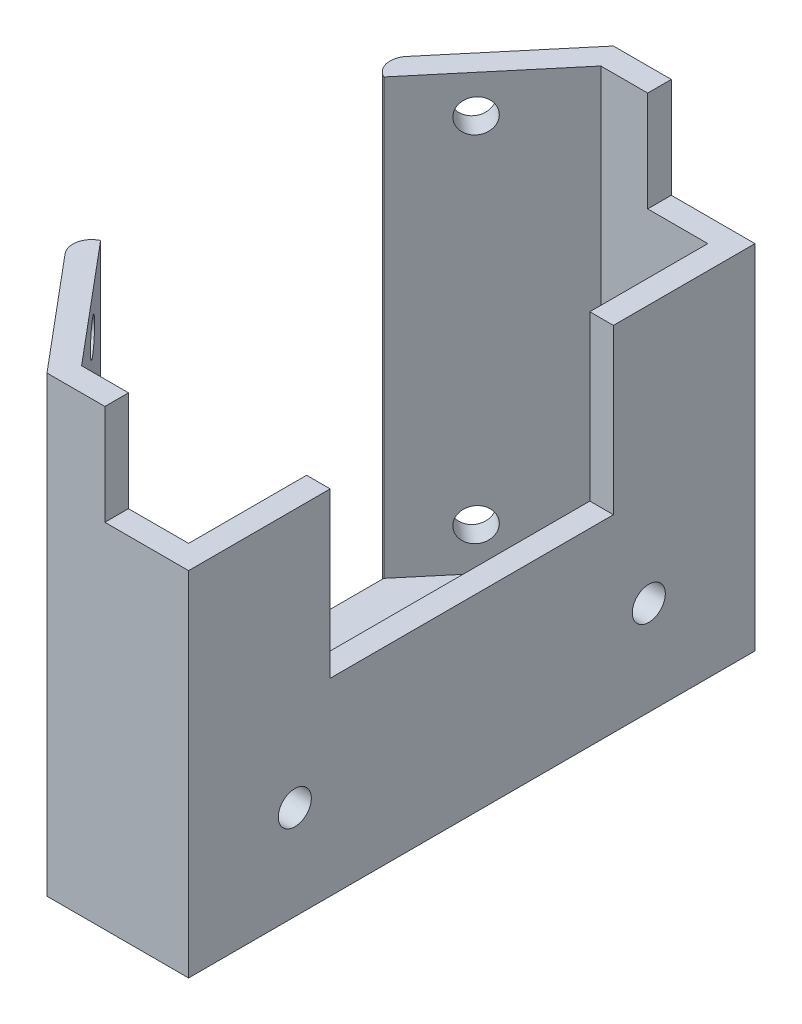
from build123d import *

# Parameters (mm, degrees)
SKETCH_1_W          = 15
SKETCH_1_H          = 60
EXTRUDE_1_DEPTH     = 55
CUT_EXTRUDE_1_DEPTH = 53
SKETCH_3_W          = 78.566437997
SKETCH_3_H          = 30
CUT_EXTRUDE_2_DEPTH = 35
CUT_EXTRUDE_3_DEPTH = 25
FILLET_1_R          = 2
SKETCH_5_R          = 1.75
CUT_EXTRUDE_4_DEPTH = 3
SKETCH_6_R          = 1.75
CUT_EXTRUDE_5_DEPTH = 3
SKETCH_7_R          = 1.75
CUT_EXTRUDE_6_DEPTH = 3
SKETCH_8_W          = 60
SKETCH_8_H          = 7
CUT_EXTRUDE_7_DEPTH = 68.625993731
SKETCH_9_R          = 1.75
CUT_EXTRUDE_8_DEPTH = 10
SKETCH_10_W         = 8.867546431
SKETCH_10_H         = 10.62822389
CUT_EXTRUDE_9_DEPTH = 78


with BuildPart() as part:
    # 草图1 → 凸台-拉伸1 (new body)
    with BuildSketch(Plane(origin=(0, 0, 0), x_dir=(1, 0, 0), z_dir=(0, 1, 0))):
        Polygon((-7.5, 30), (-32.672988935, 0), (-7.5, -30), align=None)
        Rectangle(SKETCH_1_W, SKETCH_1_H)
    extrude(amount=EXTRUDE_1_DEPTH)

    # 草图2 → 切除-拉伸1 (cut)
    with BuildSketch(Plane(origin=(0, 55, 0), x_dir=(1, 0, 0), z_dir=(0, 1, 0))):
        Polygon((-6.334230855, 27.5), (-29.409470712, 0), (-6.334230855, -27.5), (5, -27.5), (5, 27.5), align=None)
    extrude(amount=-CUT_EXTRUDE_1_DEPTH, mode=Mode.SUBTRACT)

    # 草图3 → 切除-拉伸2 (cut)
    with BuildSketch(Plane(origin=(0, 55, 0), x_dir=(1, 0, 0), z_dir=(0, 1, 0))):
        with Locations((-12.586494467, 0)):
            Rectangle(SKETCH_3_W, SKETCH_3_H)
    extrude(amount=-CUT_EXTRUDE_2_DEPTH, mode=Mode.SUBTRACT)

    # 草图4 → 切除-拉伸3 (cut)
    with BuildSketch(Plane(origin=(0, 20, 0), x_dir=(1, 0, 0), z_dir=(0, 1, 0))):
        Polygon((-16.822976244, 15), (-73.584466249, 15), (-53.824577323, -15), (-16.822976244, -15), align=None)
    extrude(amount=-CUT_EXTRUDE_3_DEPTH, mode=Mode.SUBTRACT)

    # 圆角1
    # the kernel refuses this fillet: 2 mm, written as the material it takes off along each edge
    with BuildSketch(Plane(origin=(-20.086494468, 65.085601878, 15), x_dir=(1, 0, 0), z_dir=(0, -1, 0))) as fillet_1_piece_1:
        with BuildLine():
            CenterArc((4.125248856, 1.80483249), FILLET_1_R, 140, 104.477512186)
            Line((2.593159969, 3.09040771), (2.562518192, 3.116119214))
            Line((2.562518192, 3.116119214), (-0.030641778, 0.025711504))
            Line((-0.030641778, 0.025711504), (0, -0.04))
            ThreePointArc((0, -0.04), (1.631759112, -0.04), (3.246283611, -0.03609665))
            Line((3.246283611, -0.03609665), (3.263518223, 0))
        make_face()
    extrude(amount=75.171203755, mode=Mode.SUBTRACT)
    with BuildSketch(Plane(origin=(-20.086494468, -10.085601878, -15), x_dir=(0.6427876096865405, 0, -0.7660444431189769), z_dir=(0, 1, 0))) as fillet_1_piece_2:
        with BuildLine():
            CenterArc((4.034240751, -2), FILLET_1_R, 90, 104.477512186)
            Line((2.097749078, -2.5), (2.059019244, -2.51))
            ThreePointArc((2.059019244, -2.51), (1.018232761, -1.275711504), (-0.030641778, -0.025711504))
            Line((-0.030641778, -0.025711504), (0, 0.04))
            Line((0, 0.04), (4.034240751, 0.04))
            Line((4.034240751, 0.04), (4.034240751, 0))
        make_face()
    extrude(amount=75.171203755, mode=Mode.SUBTRACT)

    # 草图5 → 切除-拉伸4 (cut)
    with BuildSketch(Plane(origin=(-19.173296961, 0, 16.088306409), x_dir=(0.6427876096865413, 0, 0.7660444431189765), z_dir=(-0.7660444431189765, 0, 0.6427876096865413))):
        with Locations((7.613557632, 44)):
            Circle(SKETCH_5_R)
        with Locations((6.613557632, 6.513335705)):
            Circle(SKETCH_5_R)
    extrude(amount=-CUT_EXTRUDE_4_DEPTH, mode=Mode.SUBTRACT)

    # 草图6 → 切除-拉伸5 (cut)
    with BuildSketch(Plane(origin=(-19.173296961, 0, -16.088306409), x_dir=(-0.642787609686541, 0, 0.7660444431189768), z_dir=(-0.7660444431189768, 0, -0.642787609686541))):
        with Locations((-7.613557632, 44)):
            Circle(SKETCH_6_R)
        with Locations((-7.613557632, 6.5)):
            Circle(SKETCH_6_R)
    extrude(amount=-CUT_EXTRUDE_5_DEPTH, mode=Mode.SUBTRACT)

    # 草图7 → 切除-拉伸6 (cut)
    with BuildSketch(Plane(origin=(7.5, 0, 0), x_dir=(0, 0, -1), z_dir=(1, 0, 0))):
        with Locations((18.75, 10)):
            Circle(SKETCH_7_R)
        with Locations(Location((-18.75, 10, 0), (0, 0, 180))):
            Circle(SKETCH_7_R)
    extrude(amount=-CUT_EXTRUDE_6_DEPTH, mode=Mode.SUBTRACT)

    # 草图8 → 切除-拉伸7 (cut, through all)
    with BuildSketch(Plane(origin=(7.5, 0, 0), x_dir=(0, 0, -1), z_dir=(1, 0, 0))):
        with Locations((0, 51.5)):
            Rectangle(SKETCH_8_W, SKETCH_8_H)
    extrude(amount=-CUT_EXTRUDE_7_DEPTH, mode=Mode.SUBTRACT)

    # 草图9 → 切除-拉伸8 (cut)
    with BuildSketch(Plane(origin=(0, 2, 0), x_dir=(1, 0, 0), z_dir=(0, 1, 0))):
        with Locations(Location((-0.667115427, -23.5, 0), (0, 0, 270))):
            Circle(SKETCH_9_R)
        with Locations(Location((-0.667115427, 23.5, 0), (0, 0, 270))):
            Circle(SKETCH_9_R)
    extrude(amount=-CUT_EXTRUDE_8_DEPTH, mode=Mode.SUBTRACT)

    # 草图10 → 切除-拉伸9 (cut)
    with BuildSketch(Plane.XY.offset(30)):
        with Locations((3.066226785, 42.685888055)):
            Rectangle(SKETCH_10_W, SKETCH_10_H)
    extrude(amount=-CUT_EXTRUDE_9_DEPTH, mode=Mode.SUBTRACT)


solid = part.part
